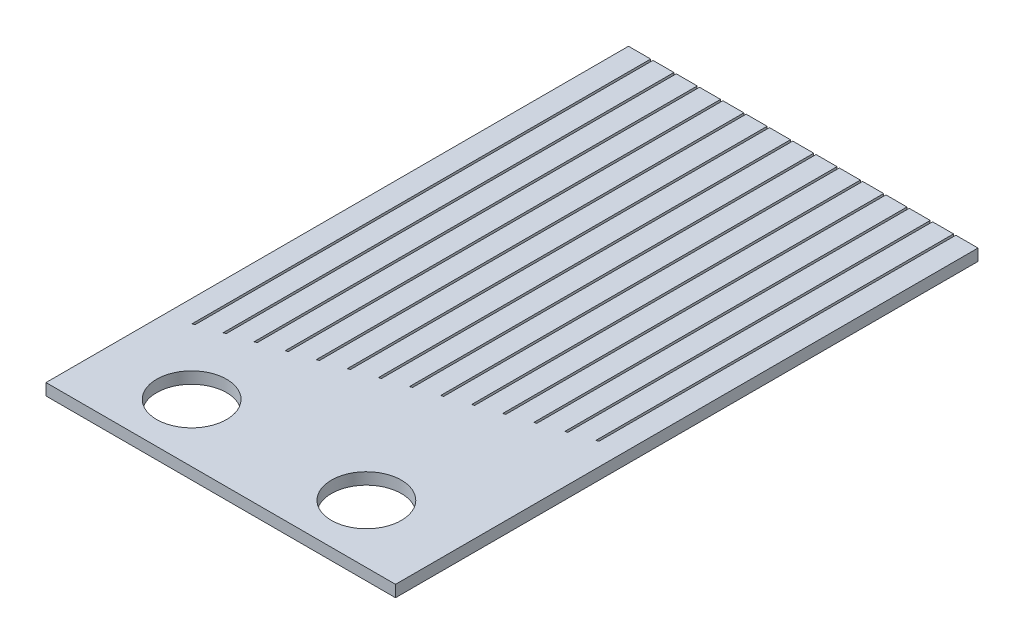
from build123d import *

# Parameters (mm, degrees)
SKETCH1_R           = 1.5
BOSS_EXTRUDE1_DEPTH = 0.5


with BuildPart() as part:
    # Sketch1 → Boss-Extrude1 (new body)
    with BuildSketch(Plane(origin=(0, 0, 0), x_dir=(1, 0, 0), z_dir=(0, 1, 0))):
        Polygon((-7.5, 12.5), (-7.5, -12.5), (7.5, -12.5), (7.5, 12.5), (6.55, 12.5), (6.55, -2.816666667), (6.45, -2.85), (6.45, 12.5), (5.55, 12.5), (5.55, -3.15), (5.45, -3.183333333), (5.45, 12.5), (4.55, 12.5), (4.55, -3.483333333), (4.45, -3.516666667), (4.45, 12.5), (3.55, 12.5), (3.55, -3.816666667), (3.45, -3.85), (3.45, 12.5), (2.55, 12.5), (2.55, -4.15), (2.45, -4.183333333), (2.45, 12.5), (1.55, 12.5), (1.55, -4.483333333), (1.45, -4.516666667), (1.45, 12.5), (0.55, 12.5), (0.55, -4.816666667), (0.45, -4.85), (0.45, 12.5), (-0.45, 12.5), (-0.45, -5.15), (-0.55, -5.183333333), (-0.55, 12.5), (-1.45, 12.5), (-1.45, -5.483333333), (-1.55, -5.516666667), (-1.55, 12.5), (-2.45, 12.5), (-2.45, -5.816666667), (-2.55, -5.85), (-2.55, 12.5), (-3.45, 12.5), (-3.45, -6.15), (-3.55, -6.183333333), (-3.55, 12.5), (-4.45, 12.5), (-4.45, -6.483333333), (-4.55, -6.516666667), (-4.55, 12.5), (-5.45, 12.5), (-5.45, -6.816666667), (-5.55, -6.85), (-5.55, 12.5), (-6.45, 12.5), (-6.45, -7.15), (-6.55, -7.183333333), (-6.55, 12.5), align=None)
        with Locations((3.75, -10)):
            Circle(SKETCH1_R, mode=Mode.SUBTRACT)
        with Locations((-3.75, -10)):
            Circle(SKETCH1_R, mode=Mode.SUBTRACT)
    extrude(amount=BOSS_EXTRUDE1_DEPTH)


solid = part.part
